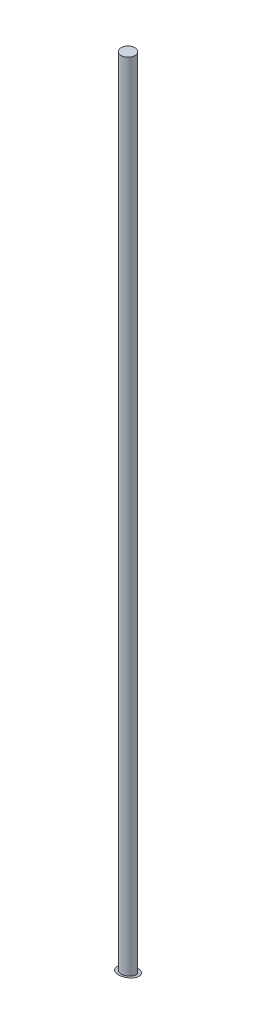
from build123d import *

# Parameters (mm, degrees)
SKETCH_1_R          = 1.25
EXTRUDE_1_DEPTH     = 145
CUT_EXTRUDE_1_DEPTH = 6
SKETCH_4_R          = 1.75
EXTRUDE_3_DEPTH     = 2
EXTRUDE_3_TAPER     = 64


with BuildPart() as part:
    # Эскиз1 → Бобышка-Вытянуть1 (new body)
    with BuildSketch(Plane(origin=(0, 0, 0), x_dir=(1, 0, 0), z_dir=(0, 1, 0))):
        Circle(SKETCH_1_R)
    extrude(amount=EXTRUDE_1_DEPTH)

    # Эскиз3 → Вырез-Вытянуть1 (cut, symmetric)
    with BuildSketch(Plane(origin=(0, 0, 0), x_dir=(0, 0, -1), z_dir=(1, 0, 0))):
        Polygon((1.25, 0), (-2.080626709, 0.599874475), (-2.080626709, 0), align=None)
    extrude(amount=CUT_EXTRUDE_1_DEPTH, both=True, mode=Mode.SUBTRACT)

    # Эскиз4 → Бобышка-Вытянуть3 (add)
    with BuildSketch(Plane(origin=(0, 0.218062, -0.039274839), x_dir=(1, 0, 0), z_dir=(0, -0.9841646858615077, 0.177256512159977))):
        with Locations((0, 0.040379775)):
            Circle(SKETCH_4_R)
    extrude(amount=EXTRUDE_3_DEPTH, taper=EXTRUDE_3_TAPER)


solid = part.part
